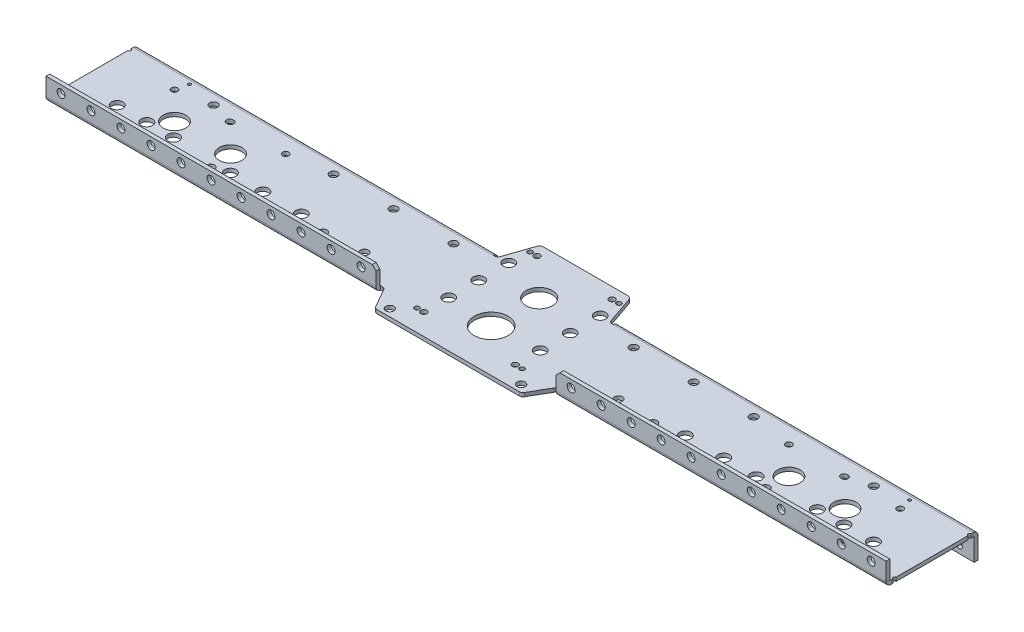
from build123d import *

# Parameters (mm, degrees)
SKETCH1_W                      = 812.8
SKETCH1_H                      = 69.85
BOSS_EXTRUDE1_DEPTH            = 3.175
SKETCH3_R                      = 14.2875
CUT_EXTRUDE1_DEPTH             = 816.802024467
EDGE_FLANGE1_DEPTH             = 812.8
EDGE_FLANGE2_DEPTH             = 812.8
SKETCH10_R                     = 4.826
LONG_6WD_DEPTH                 = 817.444922817
SKETCH11_R                     = 4.826
SHORT_6WD_DEPTH                = 817.444922817
SKETCH12_R                     = 3.3528
F_8WD_EGG_DEPTH                = 817.444922817
SKETCH13_R                     = 3.3528
LOWER_CHURRO_DEPTH             = 817.444922817
SKETCH14_R                     = 2.667
UPPER_FLANGE_HP_DEPTH          = 817.729920277
SKETCH16_R                     = 3.3528
LOWER_FLANGE_HP_DEPTH          = 817.433889486
LPATTERN1_COUNT                = 32
LPATTERN1_PITCH                = 25.4
SKETCH17_W                     = 152.4
SKETCH17_H                     = 6.35
CUT_EXTRUDE9_DEPTH             = 818.031193633
SKETCH18_W                     = 146.05
SKETCH18_H                     = 3.175
BOSS_EXTRUDE2_DEPTH            = 19.05
SKETCH19_W                     = 101.6
SKETCH19_H                     = 3.937
CUT_EXTRUDE10_DEPTH            = 818.031193633
SKETCH20_W                     = 95.25
SKETCH20_H                     = 3.175
BOSS_EXTRUDE3_DEPTH            = 27.432
CUT_EXTRUDE14_DEPTH            = 819.902667079
SKETCH21_R                     = 11.1125
SKETCH21_R_2                   = 4.7625
SKETCH21_R_3                   = 2.54
SKETCH21_R_4                   = 2.032
TB_MINI_SHAFT_PLATE_DEPTH      = 819.8226487
CUT_EXTRUDE12_DEPTH            = 819.8226487
SKETCH23_R                     = 3.3528
UPPER_INTERNAL_CHIRRO_HP_DEPTH = 819.8226487
SKETCH24_R                     = 1.27
CUTTING_GUIDES_DEPTH           = 819.8226487
SKETCH26_R                     = 3.4036
SONIC_MOUNTING_HOLES_DEPTH     = 819.902667079
SKETCH25_R                     = 9.525
SKETCH25_R_2                   = 2.667
MECANUM_LONG_DEPTH             = 3.175
FILLET1_R                      = 3.175
CHAMFER1_SIZE                  = 3.175
SKETCH29_R                     = 9.525
SKETCH29_R_2                   = 2.667
CUT_EXTRUDE15_DEPTH            = 819.902667079
CUT_EXTRUDE16_DEPTH            = 819.902667079
CUT_EXTRUDE16_DEPTH_BACK       = 819.902667079
SKETCH30_OUTSIDE_W             = 979.194
SKETCH30_OUTSIDE_H             = 282.726
SKETCH30_OUTSIDE_W_2           = 711.2
SKETCH30_OUTSIDE_H_2           = 205.411421364


# Sheet-metal steps are written as plain solids
with BuildPart() as part:
    # Sketch1 → Boss-Extrude1 (new body)
    with BuildSketch(Plane(origin=(0, 0, 0), x_dir=(1, 0, 0), z_dir=(0, 1, 0))):
        with Locations((406.4, 34.925)):
            Rectangle(SKETCH1_W, SKETCH1_H)
    extrude(amount=BOSS_EXTRUDE1_DEPTH)

    # Sketch3 → Cut-Extrude1 (cut, through all)
    with BuildSketch(Plane(origin=(0, 3.175, 0), x_dir=(1, 0, 0), z_dir=(0, 1, 0))):
        with Locations(Location((406.4, 17.272, 0), (0, 0, 270))):
            Circle(SKETCH3_R)
    extrude(amount=-CUT_EXTRUDE1_DEPTH, mode=Mode.SUBTRACT)

    # Edge-Flange1 section (across the edge) → Edge-Flange1 (add)
    with BuildSketch(Plane(origin=(0, 3.175, 0.762), x_dir=(0, 0, -1), z_dir=(1, 0, 0))):
        with BuildLine():
            Line((-3.175, 0.762), (-3.175, 15.875))
            Line((-3.175, 15.875), (0, 15.875))
            Line((0, 15.875), (0, 0.762))
            ThreePointArc((0, 0.762), (0.223184633, 0.223184633), (0.762, 0))
            Line((0.762, 0), (0.762, -3.175))
            ThreePointArc((0.762, -3.175), (-2.021879398, -2.021879398), (-3.175, 0.762))
        make_face()
    extrude(amount=EDGE_FLANGE1_DEPTH)

    # Edge-Flange2 section (across the edge) → Edge-Flange2 (add)
    with BuildSketch(Plane(origin=(0, 0, -70.612), x_dir=(0, 0, 1), z_dir=(1, 0, 0))):
        with BuildLine():
            Line((-3.175, 0.762), (-3.175, 19.05))
            Line((-3.175, 19.05), (0, 19.05))
            Line((0, 19.05), (0, 0.762))
            ThreePointArc((0, 0.762), (0.223184633, 0.223184633), (0.762, 0))
            Line((0.762, 0), (0.762, -3.175))
            ThreePointArc((0.762, -3.175), (-2.021879398, -2.021879398), (-3.175, 0.762))
        make_face()
    extrude(amount=EDGE_FLANGE2_DEPTH)

    # Sketch10 → Long 6wd (cut, through all)
    with BuildSketch(Plane(origin=(0, 3.175, 0), x_dir=(1, 0, 0), z_dir=(0, 1, 0))):
        with Locations(Location((86.339113657, 20.828, 0), (0, 0, 270))):
            Circle(SKETCH10_R)
        with Locations(Location((111.349627997, 20.828, 0), (0, 0, 270))):
            Circle(SKETCH10_R)
        with Locations(Location((133.855797334, 20.828, 0), (0, 0, 270))):
            Circle(SKETCH10_R)
        with Locations(Location((726.460886343, 20.828, 0), (0, 0, 270))):
            Circle(SKETCH10_R)
        with Locations(Location((701.450372003, 20.828, 0), (0, 0, 270))):
            Circle(SKETCH10_R)
        with Locations(Location((678.944202666, 20.828, 0), (0, 0, 270))):
            Circle(SKETCH10_R)
    extrude(amount=-LONG_6WD_DEPTH, mode=Mode.SUBTRACT)

    # Sketch11 → Short 6wd (cut, through all)
    with BuildSketch(Plane(origin=(0, 3.175, 0), x_dir=(1, 0, 0), z_dir=(0, 1, 0))):
        with Locations(Location((183.852302373, 19.05, 0), (0, 0, 270))):
            Circle(SKETCH11_R)
        with Locations(Location((211.361504088, 19.05, 0), (0, 0, 270))):
            Circle(SKETCH11_R)
        with Locations(Location((243.875125248, 19.05, 0), (0, 0, 270))):
            Circle(SKETCH11_R)
        with Locations(Location((568.924874752, 19.05, 0), (0, 0, 270))):
            Circle(SKETCH11_R)
        with Locations(Location((601.438495912, 19.05, 0), (0, 0, 270))):
            Circle(SKETCH11_R)
        with Locations(Location((628.947697627, 19.05, 0), (0, 0, 270))):
            Circle(SKETCH11_R)
    extrude(amount=-SHORT_6WD_DEPTH, mode=Mode.SUBTRACT)

    # Sketch12 → 8wd egg (cut, through all)
    with BuildSketch(Plane(origin=(0, 3.175, 0), x_dir=(1, 0, 0), z_dir=(0, 1, 0))):
        with Locations(Location((298.874532383, 17.547282407, 0), (0, 0, 270))):
            Circle(SKETCH12_R)
        with Locations(Location((513.925467617, 17.547282407, 0), (0, 0, 270))):
            Circle(SKETCH12_R)
    extrude(amount=-F_8WD_EGG_DEPTH, mode=Mode.SUBTRACT)

    # Sketch13 → lower churro (cut, through all)
    with BuildSketch(Plane(origin=(0, 3.175, 0), x_dir=(1, 0, 0), z_dir=(0, 1, 0))):
        with Locations(Location((171.45, 14.732, 0), (0, 0, 270))):
            Circle(SKETCH13_R)
        with Locations(Location((266.7, 14.732, 0), (0, 0, 270))):
            Circle(SKETCH13_R)
        with Locations(Location((546.1, 14.732, 0), (0, 0, 270))):
            Circle(SKETCH13_R)
        with Locations(Location((641.35, 14.732, 0), (0, 0, 270))):
            Circle(SKETCH13_R)
    extrude(amount=-LOWER_CHURRO_DEPTH, mode=Mode.SUBTRACT)

    # Sketch14 → upper flange HP (cut, through all)
    with BuildSketch(Plane(origin=(0, 0, -73.787), x_dir=(-1, 0, 0), z_dir=(0, 0, -1))):
        with Locations(Location((-12.7, -12.7, 0), (0, 0, 90))):
            Circle(SKETCH14_R)
        with Locations(Location((-38.1, -12.7, 0), (0, 0, 90))):
            Circle(SKETCH14_R)
        with Locations(Location((-63.5, -12.7, 0), (0, 0, 90))):
            Circle(SKETCH14_R)
        with Locations(Location((-88.9, -12.7, 0), (0, 0, 90))):
            Circle(SKETCH14_R)
        with Locations(Location((-114.3, -12.7, 0), (0, 0, 90))):
            Circle(SKETCH14_R)
        with Locations(Location((-139.7, -12.7, 0), (0, 0, 90))):
            Circle(SKETCH14_R)
        with Locations(Location((-165.1, -12.7, 0), (0, 0, 90))):
            Circle(SKETCH14_R)
        with Locations(Location((-190.5, -12.7, 0), (0, 0, 90))):
            Circle(SKETCH14_R)
        with Locations(Location((-215.9, -12.7, 0), (0, 0, 90))):
            Circle(SKETCH14_R)
        with Locations(Location((-241.3, -12.7, 0), (0, 0, 90))):
            Circle(SKETCH14_R)
        with Locations(Location((-266.7, -12.7, 0), (0, 0, 90))):
            Circle(SKETCH14_R)
        with Locations(Location((-292.1, -12.7, 0), (0, 0, 90))):
            Circle(SKETCH14_R)
        with Locations(Location((-317.5, -12.7, 0), (0, 0, 90))):
            Circle(SKETCH14_R)
        with Locations(Location((-342.9, -12.7, 0), (0, 0, 90))):
            Circle(SKETCH14_R)
        with Locations(Location((-368.3, -12.7, 0), (0, 0, 90))):
            Circle(SKETCH14_R)
        with Locations(Location((-393.7, -12.7, 0), (0, 0, 90))):
            Circle(SKETCH14_R)
        with Locations(Location((-419.1, -12.7, 0), (0, 0, 90))):
            Circle(SKETCH14_R)
        with Locations(Location((-444.5, -12.7, 0), (0, 0, 90))):
            Circle(SKETCH14_R)
        with Locations(Location((-469.9, -12.7, 0), (0, 0, 90))):
            Circle(SKETCH14_R)
        with Locations(Location((-495.3, -12.7, 0), (0, 0, 90))):
            Circle(SKETCH14_R)
        with Locations(Location((-520.7, -12.7, 0), (0, 0, 90))):
            Circle(SKETCH14_R)
        with Locations(Location((-546.1, -12.7, 0), (0, 0, 90))):
            Circle(SKETCH14_R)
        with Locations(Location((-571.5, -12.7, 0), (0, 0, 90))):
            Circle(SKETCH14_R)
        with Locations(Location((-596.9, -12.7, 0), (0, 0, 90))):
            Circle(SKETCH14_R)
        with Locations(Location((-622.3, -12.7, 0), (0, 0, 90))):
            Circle(SKETCH14_R)
        with Locations(Location((-647.7, -12.7, 0), (0, 0, 90))):
            Circle(SKETCH14_R)
        with Locations(Location((-673.1, -12.7, 0), (0, 0, 90))):
            Circle(SKETCH14_R)
        with Locations(Location((-698.5, -12.7, 0), (0, 0, 90))):
            Circle(SKETCH14_R)
        with Locations(Location((-723.9, -12.7, 0), (0, 0, 90))):
            Circle(SKETCH14_R)
        with Locations(Location((-749.3, -12.7, 0), (0, 0, 90))):
            Circle(SKETCH14_R)
        with Locations(Location((-774.7, -12.7, 0), (0, 0, 90))):
            Circle(SKETCH14_R)
        with Locations(Location((-800.1, -12.7, 0), (0, 0, 90))):
            Circle(SKETCH14_R)
    extrude(amount=-UPPER_FLANGE_HP_DEPTH, mode=Mode.SUBTRACT)

    # Sketch16 → Lower flange HP (cut, through all)
    with BuildSketch(Plane(origin=(0, 0, 0.762), x_dir=(-1, 0, 0), z_dir=(0, 0, -1))):
        with Locations(Location((-12.7, 12.7, 0), (0, 0, 90))):
            Circle(SKETCH16_R)
    lower_flange_hp = extrude(amount=-LOWER_FLANGE_HP_DEPTH, mode=Mode.SUBTRACT)

    # LPattern1: Lower flange HP ×32
    with Locations(*[(i * LPATTERN1_PITCH, 0, 0) for i in range(1, LPATTERN1_COUNT)]):
        add(lower_flange_hp, mode=Mode.SUBTRACT)

    # Sketch17 → Cut-Extrude9 (cut, through all)
    with BuildSketch(Plane(origin=(0, 19.05, 0), x_dir=(1, 0, 0), z_dir=(0, 1, 0))):
        with Locations((406.4, -3.175)):
            Rectangle(SKETCH17_W, SKETCH17_H)
    extrude(amount=-CUT_EXTRUDE9_DEPTH, mode=Mode.SUBTRACT)

    # Sketch18 → Boss-Extrude2 (add)
    with BuildSketch(Plane.XY):
        with Locations((406.4, 1.5875)):
            Rectangle(SKETCH18_W, SKETCH18_H)
    extrude(amount=BOSS_EXTRUDE2_DEPTH)

    # Sketch19 → Cut-Extrude10 (cut, through all)
    with BuildSketch(Plane.XZ.offset(19.05)):
        with Locations((406.4, -71.8185)):
            Rectangle(SKETCH19_W, SKETCH19_H)
    extrude(amount=-CUT_EXTRUDE10_DEPTH, mode=Mode.SUBTRACT)

    # Sketch20 → Boss-Extrude3 (add)
    with BuildSketch(Plane(origin=(0, 0, -69.85), x_dir=(-1, 0, 0), z_dir=(0, 0, -1))):
        with Locations((-406.4, 1.5875)):
            Rectangle(SKETCH20_W, SKETCH20_H)
    extrude(amount=BOSS_EXTRUDE3_DEPTH)

    # Sketch27 → Cut-Extrude14 (cut, through all)
    with BuildSketch(Plane(origin=(0, 3.175, 0), x_dir=(1, 0, 0), z_dir=(0, 1, 0))):
        Polygon((333.375, 0), (344.373522628, -19.05), (333.375, -19.05), align=None)
        Polygon((479.425, 0), (479.425, -19.05), (468.426477372, -19.05), align=None)
    extrude(amount=-CUT_EXTRUDE14_DEPTH, mode=Mode.SUBTRACT)

    # Sketch21 → TB Mini Shaft plate (cut, through all)
    with BuildSketch(Plane.XZ):
        with Locations(Location((406.4, -57.9628, 0), (0, 0, 270))):
            Circle(SKETCH21_R)
        with Locations(Location((445.12429721, -45.466, 0), (0, 0, 270))):
            Circle(SKETCH21_R_2)
        with Locations(Location((367.67570279, -45.466, 0), (0, 0, 270))):
            Circle(SKETCH21_R_2)
        with Locations(Location((445.12429721, -70.866, 0), (0, 0, 270))):
            Circle(SKETCH21_R_2)
        with Locations(Location((445.12429721, -20.066, 0), (0, 0, 270))):
            Circle(SKETCH21_R_2)
        with Locations(Location((367.67570279, -20.066, 0), (0, 0, 270))):
            Circle(SKETCH21_R_2)
        with Locations(Location((367.67570279, -70.866, 0), (0, 0, 270))):
            Circle(SKETCH21_R_2)
        with Locations(Location((438.15, -87.85352, 0), (0, 0, 270))):
            Circle(SKETCH21_R_3)
        with Locations(Location((374.65, -87.85352, 0), (0, 0, 270))):
            Circle(SKETCH21_R_3)
        with Locations(Location((443.992, -87.85352, 0), (0, 0, 270))):
            Circle(SKETCH21_R_4)
        with Locations(Location((368.808, -87.85352, 0), (0, 0, 270))):
            Circle(SKETCH21_R_4)
        with Locations(Location((445.0461, 1.03886, 0), (0, 0, 270))):
            Circle(SKETCH21_R_3)
        with Locations(Location((367.7539, 1.03886, 0), (0, 0, 270))):
            Circle(SKETCH21_R_3)
        with Locations(Location((361.9119, 1.03886, 0), (0, 0, 270))):
            Circle(SKETCH21_R_4)
        with Locations(Location((450.8881, 1.03886, 0), (0, 0, 270))):
            Circle(SKETCH21_R_4)
    extrude(amount=-TB_MINI_SHAFT_PLATE_DEPTH, mode=Mode.SUBTRACT)

    # Sketch22 → Cut-Extrude12 (cut, through all)
    with BuildSketch(Plane.XZ):
        Polygon((454.025, -69.85), (444.579404912, -97.282), (454.025, -97.282), align=None)
        Polygon((358.775, -69.85), (368.220595088, -97.282), (358.775, -97.282), align=None)
    extrude(amount=-CUT_EXTRUDE12_DEPTH, mode=Mode.SUBTRACT)

    # Sketch23 → Upper internal chirro HP (cut, through all)
    with BuildSketch(Plane.XZ):
        with Locations(Location((330.2, -61.722, 0), (0, 0, 270))):
            Circle(SKETCH23_R)
        with Locations(Location((279.4, -61.722, 0), (0, 0, 270))):
            Circle(SKETCH23_R)
        with Locations(Location((228.6, -61.722, 0), (0, 0, 270))):
            Circle(SKETCH23_R)
        with Locations(Location((127, -61.722, 0), (0, 0, 270))):
            Circle(SKETCH23_R)
        with Locations(Location((25.4, -61.722, 0), (0, 0, 270))):
            Circle(SKETCH23_R)
        with Locations(Location((482.6, -61.722, 0), (0, 0, 270))):
            Circle(SKETCH23_R)
        with Locations(Location((533.4, -61.722, 0), (0, 0, 270))):
            Circle(SKETCH23_R)
        with Locations(Location((584.2, -61.722, 0), (0, 0, 270))):
            Circle(SKETCH23_R)
        with Locations(Location((685.8, -61.722, 0), (0, 0, 270))):
            Circle(SKETCH23_R)
        with Locations(Location((787.4, -61.722, 0), (0, 0, 270))):
            Circle(SKETCH23_R)
        with Locations(Location((6.35, -39.497, 0), (0, 0, 270))):
            Circle(SKETCH23_R)
        with Locations(Location((806.45, -39.497, 0), (0, 0, 270))):
            Circle(SKETCH23_R)
    extrude(amount=-UPPER_INTERNAL_CHIRRO_HP_DEPTH, mode=Mode.SUBTRACT)

    # Sketch24 → Cutting guides (cut, through all)
    with BuildSketch(Plane.XZ):
        with Locations(Location((101.6, -3.175, 0), (0, 0, 270))):
            Circle(SKETCH24_R)
        with Locations(Location((101.6, -66.675, 0), (0, 0, 270))):
            Circle(SKETCH24_R)
        with Locations(Location((50.8, -66.675, 0), (0, 0, 270))):
            Circle(SKETCH24_R)
        with Locations(Location((50.8, -3.175, 0), (0, 0, 270))):
            Circle(SKETCH24_R)
        with Locations(Location((762, -66.675, 0), (0, 0, 270))):
            Circle(SKETCH24_R)
        with Locations(Location((762, -3.175, 0), (0, 0, 270))):
            Circle(SKETCH24_R)
        with Locations(Location((711.2, -3.175, 0), (0, 0, 270))):
            Circle(SKETCH24_R)
        with Locations(Location((711.2, -66.675, 0), (0, 0, 270))):
            Circle(SKETCH24_R)
    extrude(amount=-CUTTING_GUIDES_DEPTH, mode=Mode.SUBTRACT)

    # Sketch26 → Sonic mounting holes (cut, through all)
    with BuildSketch(Plane(origin=(0, 3.175, 0), x_dir=(1, 0, 0), z_dir=(0, 1, 0))):
        with Locations(Location((350.8375, -12.8905, 0), (0, 0, 270))):
            Circle(SKETCH26_R)
        with Locations(Location((461.9625, -12.8905, 0), (0, 0, 270))):
            Circle(SKETCH26_R)
    extrude(amount=-SONIC_MOUNTING_HOLES_DEPTH, mode=Mode.SUBTRACT)

    # Sketch25 → mecanum long (cut)
    with BuildSketch(Plane(origin=(0, 3.175, 0), x_dir=(1, 0, 0), z_dir=(0, 1, 0))):
        with Locations(Location((690.197287335, 33.02, 0), (0, 0, 270))):
            Circle(SKETCH25_R)
        with Locations(Location((713.545953249, 9.671334085, 0), (0, 0, 90))):
            Circle(SKETCH25_R_2)
        with Locations(Location((713.545953249, 56.368665915, 0), (0, 0, 90))):
            Circle(SKETCH25_R_2)
        with Locations(Location((666.84862142, 56.368665915, 0), (0, 0, 270))):
            Circle(SKETCH25_R_2)
        with Locations(Location((666.84862142, 9.671334085, 0), (0, 0, 270))):
            Circle(SKETCH25_R_2)
        with Locations(Location((99.254046751, 56.368665915, 0), (0, 0, 270))):
            Circle(SKETCH25_R_2)
        with Locations(Location((99.254046751, 9.671334085, 0), (0, 0, 270))):
            Circle(SKETCH25_R_2)
        with Locations(Location((145.95137858, 9.671334085, 0), (0, 0, 90))):
            Circle(SKETCH25_R_2)
        with Locations(Location((145.95137858, 56.368665915, 0), (0, 0, 90))):
            Circle(SKETCH25_R_2)
        with Locations(Location((122.602712665, 33.02, 0), (0, 0, 90))):
            Circle(SKETCH25_R)
    extrude(amount=-MECANUM_LONG_DEPTH, mode=Mode.SUBTRACT)

    # Fillet1
    fillet1_edges = [part.edges().sort_by_distance(p)[0] for p in [
        (333.375, 1.5875, 0),
        (479.425, 1.5875, 0),
        (454.025, 1.5875, -69.85),
        (358.775, 1.5875, -69.85),
        (468.426477372, 1.5875, 19.05),
        (344.373522628, 1.5875, 19.05),
        (368.220595088, 1.5875, -97.282),
        (444.579404912, 1.5875, -97.282),
    ]]
    fillet(fillet1_edges, radius=FILLET1_R)

    # Chamfer1
    chamfer1_edges = [part.edges().sort_by_distance(p)[0] for p in [
        (0, 19.05, 2.3495),
        (812.8, 19.05, 2.3495),
        (482.6, 19.05, 2.3495),
        (330.2, 19.05, 2.3495),
        (0, -19.05, -72.1995),
        (812.8, -19.05, -72.1995),
        (355.6, -19.05, -72.1995),
        (457.2, -19.05, -72.1995),
    ]]
    chamfer(chamfer1_edges, length=CHAMFER1_SIZE)

    # Sketch29 → Cut-Extrude15 (cut, through all)
    with BuildSketch(Plane(origin=(0, 3.175, 0), x_dir=(1, 0, 0), z_dir=(0, 1, 0))):
        with Locations(Location((642.712889143, 33.02, 0), (0, 0, 90))):
            Circle(SKETCH29_R)
        with Locations(Location((619.364223229, 56.368665915, 0), (0, 0, 90))):
            Circle(SKETCH29_R_2)
        with Locations((666.061555058, 56.368665915)):
            Circle(SKETCH29_R_2)
        with Locations((666.061555058, 9.671334085)):
            Circle(SKETCH29_R_2)
        with Locations(Location((619.364223229, 9.671334085, 0), (0, 0, 90))):
            Circle(SKETCH29_R_2)
        with Locations(Location((193.435776771, 56.368665915, 0), (0, 0, 90))):
            Circle(SKETCH29_R_2)
        with Locations((146.738444942, 56.368665915)):
            Circle(SKETCH29_R_2)
        with Locations(Location((170.087110857, 33.02, 0), (0, 0, 90))):
            Circle(SKETCH29_R)
        with Locations((146.738444942, 9.671334085)):
            Circle(SKETCH29_R_2)
        with Locations(Location((193.435776771, 9.671334085, 0), (0, 0, 90))):
            Circle(SKETCH29_R_2)
    extrude(amount=-CUT_EXTRUDE15_DEPTH, mode=Mode.SUBTRACT)

    # Sketch30 outside → Cut-Extrude16 (cut, two sides: drawn at the far end of the back side and taken through both)
    with BuildSketch(Plane(origin=(0, 3.175, 0), x_dir=(1, 0, 0), z_dir=(0, 1, 0)).offset(-CUT_EXTRUDE16_DEPTH_BACK)):
        with Locations((406.4, 39.116)):
            Rectangle(SKETCH30_OUTSIDE_W, SKETCH30_OUTSIDE_H)
        with Locations((406.4, 20.837865048)):
            Rectangle(SKETCH30_OUTSIDE_W_2, SKETCH30_OUTSIDE_H_2, mode=Mode.SUBTRACT)
    extrude(amount=CUT_EXTRUDE16_DEPTH + CUT_EXTRUDE16_DEPTH_BACK, mode=Mode.SUBTRACT)


solid = part.part
